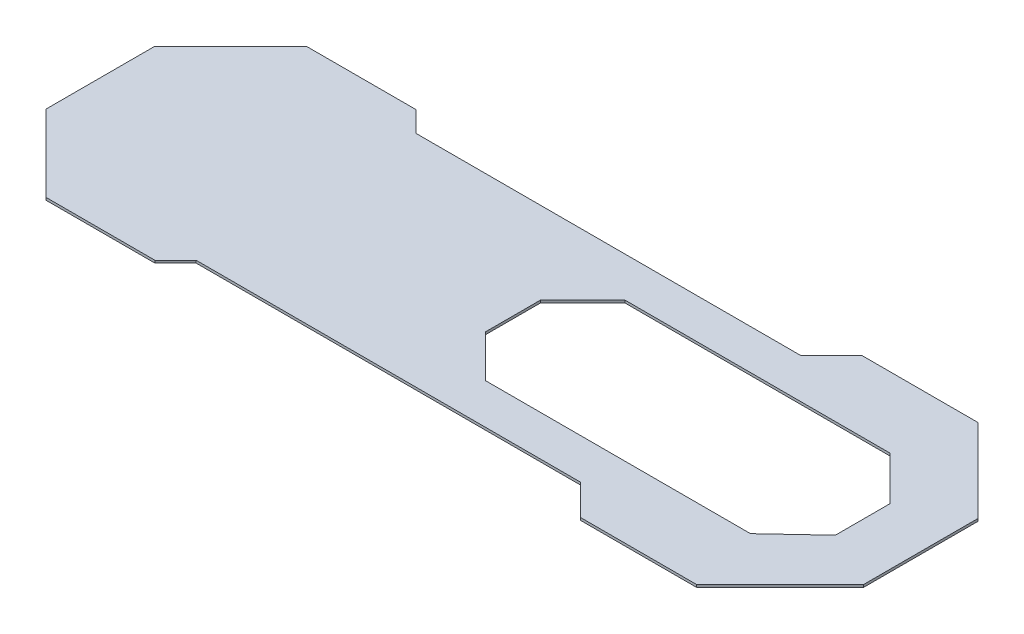
from build123d import *

# Parameters (mm, degrees)
SM_BASE_FLANGE_1_DEPTH = 1
CUT_EXTRUDE_1_DEPTH    = 10
CUT_EXTRUDE_2_DEPTH    = 10


# Sheet-metal steps are written as plain solids
with BuildPart() as part:
    # Sketch 1 → Базовая кромка1 (new body)
    with BuildSketch(Plane(origin=(0, 0, 0), x_dir=(1, 0, 0), z_dir=(0, 1, 0))):
        Polygon((-58.513846144, -161.889640506), (-212.364567845, -161.889640506), (-220.864567845, -153.389640506), (-222.278781408, -153.389640506), (-264.356991895, -153.389640506), (-295.11077987, -184.143428482), (-295.11077987, -227.635852531), (-264.356991895, -258.389640506), (-222.278781408, -258.389640506), (-220.864567845, -258.389640506), (-212.364567845, -249.889640506), (-58.513846144, -249.889640506), (-46.013846144, -262.389640506), (-44.599632582, -262.389640506), (0.278072842, -262.389640506), (33.88922013, -228.778493218), (33.88922013, -182.800787794), (0.478072842, -149.389640506), (-44.599632582, -149.389640506), (-46.013846144, -149.389640506), align=None)
    extrude(amount=-SM_BASE_FLANGE_1_DEPTH)

    # Эскиз3 → Вырез-Вытянуть1 (cut)
    with BuildSketch(Plane(origin=(0, 0, 0), x_dir=(1, 0, 0), z_dir=(0, 1, 0))):
        Polygon((-129.650630124, -194.854768426), (-112.66234875, -177.866487052), (-6.632911498, -177.866487052), (10.895241956, -195.394640506), (10.895241956, -217.265248922), (-6.633389706, -233.712753004), (-112.662389706, -233.712753004), (-129.650630124, -216.724512586), align=None)
    extrude(amount=-CUT_EXTRUDE_1_DEPTH, mode=Mode.SUBTRACT)

    # Эскиз4 → Вырез-Вытянуть2 (cut)
    with BuildSketch(Plane(origin=(0, 0, 0), x_dir=(1, 0, 0), z_dir=(0, 1, 0))):
        Polygon((-264.253438504, -153.639640506), (-216.125737308, -153.639640506), (-216.125737308, -129.066031108), (-310.48708542, -129.066031108), (-310.48708542, -280.318410607), (-216.781479831, -280.318410607), (-216.781479831, -258.139640506), (-264.253438504, -258.139640506), (-294.86077987, -227.53229914), (-294.86077987, -184.246981872), align=None)
        Polygon((-47.513022755, -149.639640506), (0.374519451, -149.639640506), (33.63922013, -182.904341185), (33.63922013, -228.674939827), (0.174519451, -262.139640506), (-50.1499885, -262.139640506), (-50.1499885, -286.805350845), (64.547971273, -286.805350845), (64.547971273, -129.066031108), (-47.513022755, -129.066031108), align=None)
    extrude(amount=-CUT_EXTRUDE_2_DEPTH, mode=Mode.SUBTRACT)


solid = part.part
